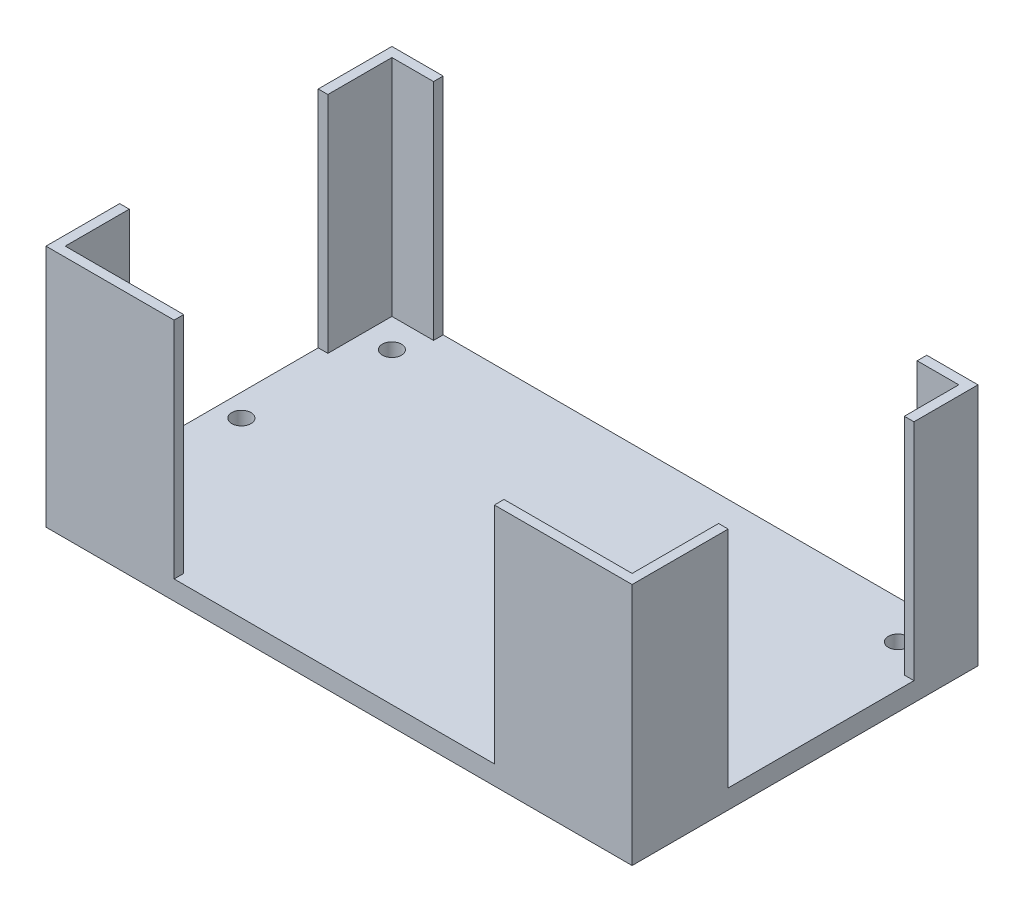
from build123d import *

# Parameters (mm, degrees)
SKETCH2_W           = 91.5
SKETCH2_H           = 54
BOSS_EXTRUDE1_DEPTH = 3
SKETCH3_R           = 1.5
CUT_EXTRUDE5_DEPTH  = 82.300643074
SKETCH5_R           = 3.025
CUT_EXTRUDE7_DEPTH  = 2.5
SKETCH6_W           = 1.5
SKETCH6_H           = 1.5
SKETCH6_W_2         = 6.5
SKETCH6_H_2         = 8.5
SKETCH6_W_3         = 20
SKETCH6_H_3         = 10
BOSS_EXTRUDE2_DEPTH = 35
SKETCH8_R           = 1.5
CUT_EXTRUDE8_DEPTH  = 89.463521094


with BuildPart() as part:
    # Sketch2 → Boss-Extrude1 (new body)
    with BuildSketch(Plane(origin=(0, 0, 0), x_dir=(1, 0, 0), z_dir=(0, 1, 0))):
        with Locations((-30.736211897, -0.398064786)):
            Rectangle(SKETCH2_W, SKETCH2_H)
    extrude(amount=BOSS_EXTRUDE1_DEPTH)

    # Sketch3 → Cut-Extrude5 (cut, through all)
    with BuildSketch(Plane(origin=(0, 3, 0), x_dir=(1, 0, 0), z_dir=(0, 1, 0))):
        with Locations((-14.486211897, 11.601935214)):
            Circle(SKETCH3_R)
        with Locations((-14.486211897, -12.398064786)):
            Circle(SKETCH3_R)
        with Locations((-72.986211897, -0.398064786)):
            Circle(SKETCH3_R)
    extrude(amount=-CUT_EXTRUDE5_DEPTH, mode=Mode.SUBTRACT)

    # Sketch5 → Cut-Extrude7 (cut)
    with BuildSketch(Plane(origin=(0, 0, 0), x_dir=(-1, 0, 0), z_dir=(0, -1, 0))):
        with Locations((27.486211897, 14.851935214)):
            Circle(SKETCH5_R)
        with Locations((27.486211897, -15.648064786)):
            Circle(SKETCH5_R)
        with Locations((57.986211897, -15.648064786)):
            Circle(SKETCH5_R)
        with Locations((57.986211897, 14.851935214)):
            Circle(SKETCH5_R)
    extrude(amount=-CUT_EXTRUDE7_DEPTH, mode=Mode.SUBTRACT)

    # Sketch6 → Boss-Extrude2 (add)
    with BuildSketch(Plane(origin=(0, 3, 0), x_dir=(1, 0, 0), z_dir=(0, 1, 0))):
        with Locations((14.263788103, 25.851935214)):
            Rectangle(SKETCH6_W, SKETCH6_H)
        with Locations((10.263788103, 25.851935214)):
            Rectangle(SKETCH6_W_2, SKETCH6_H)
        with Locations((14.263788103, 20.851935214)):
            Rectangle(SKETCH6_W, SKETCH6_H_2)
        Polygon((15.013788103, -12.398064786), (13.513788103, -12.398064786), (13.513788103, -25.898064786), (13.513788103, -27.398064786), (15.013788103, -27.398064786), align=None)
        with Locations((3.513788103, -26.648064786)):
            Rectangle(SKETCH6_W_3, SKETCH6_H)
        with Locations((-75.736211897, -20.898064786)):
            Rectangle(SKETCH6_W, SKETCH6_H_3)
        Polygon((-74.986211897, -25.898064786), (-76.486211897, -25.898064786), (-76.486211897, -27.398064786), (-56.486211897, -27.398064786), (-56.486211897, -25.898064786), align=None)
        Polygon((-76.486211897, 26.601935214), (-76.486211897, 25.101935214), (-74.986211897, 25.101935214), (-68.486211897, 25.101935214), (-68.486211897, 26.601935214), align=None)
        with Locations((-75.736211897, 20.101935214)):
            Rectangle(SKETCH6_W, SKETCH6_H_3)
    extrude(amount=BOSS_EXTRUDE2_DEPTH)

    # Sketch8 → Cut-Extrude8 (cut, through all)
    with BuildSketch(Plane(origin=(0, 3, 0), x_dir=(1, 0, 0), z_dir=(0, 1, 0))):
        with Locations((-70.486211897, -21.398064786)):
            Circle(SKETCH8_R)
        with Locations((-70.486211897, 20.601935214)):
            Circle(SKETCH8_R)
        with Locations((8.513788103, -21.398064786)):
            Circle(SKETCH8_R)
        with Locations((8.513788103, 20.601935214)):
            Circle(SKETCH8_R)
    extrude(amount=-CUT_EXTRUDE8_DEPTH, mode=Mode.SUBTRACT)


solid = part.part
